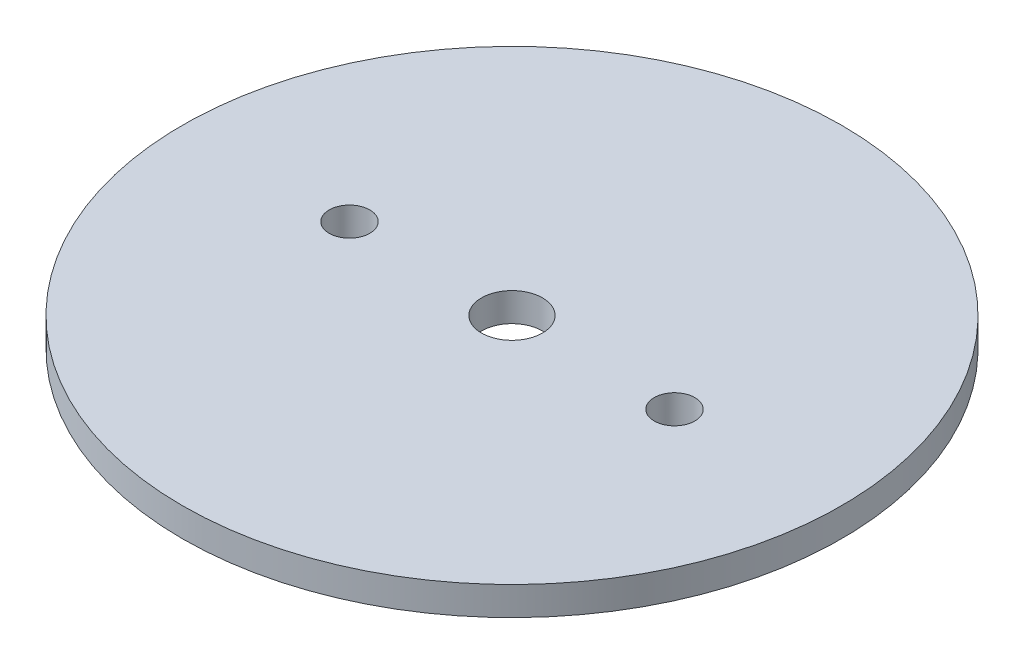
from build123d import *

# Parameters (mm, degrees)
SKETCH1_R            = 36.4998
BOSS_EXTRUDE1_DEPTH  = 1.5875
M4_CLEARANCE_HOLE1_D = 4.5
SKETCH4_R            = 3.3782
CUT_EXTRUDE1_DEPTH   = 52.716065445


with BuildPart() as part:
    # Sketch1 → Boss-Extrude1 (new, symmetric)
    with BuildSketch(Plane(origin=(0, 0, 0), x_dir=(1, 0, 0), z_dir=(0, 1, 0))):
        Circle(SKETCH1_R)
    extrude(amount=BOSS_EXTRUDE1_DEPTH, both=True)

    # M4 Clearance Hole1 (through all)
    with Locations(Plane(origin=(0, -1.5875, 0), x_dir=(-1, 0, 0), z_dir=(0, -1, 0))):
        with Locations((-18, 0), (18, 0)):
            Hole(M4_CLEARANCE_HOLE1_D / 2)

    # Sketch4 → Cut-Extrude1 (cut, through all)
    with BuildSketch(Plane.XZ.offset(1.5875)):
        Circle(SKETCH4_R)
    extrude(amount=-CUT_EXTRUDE1_DEPTH, mode=Mode.SUBTRACT)


solid = part.part
